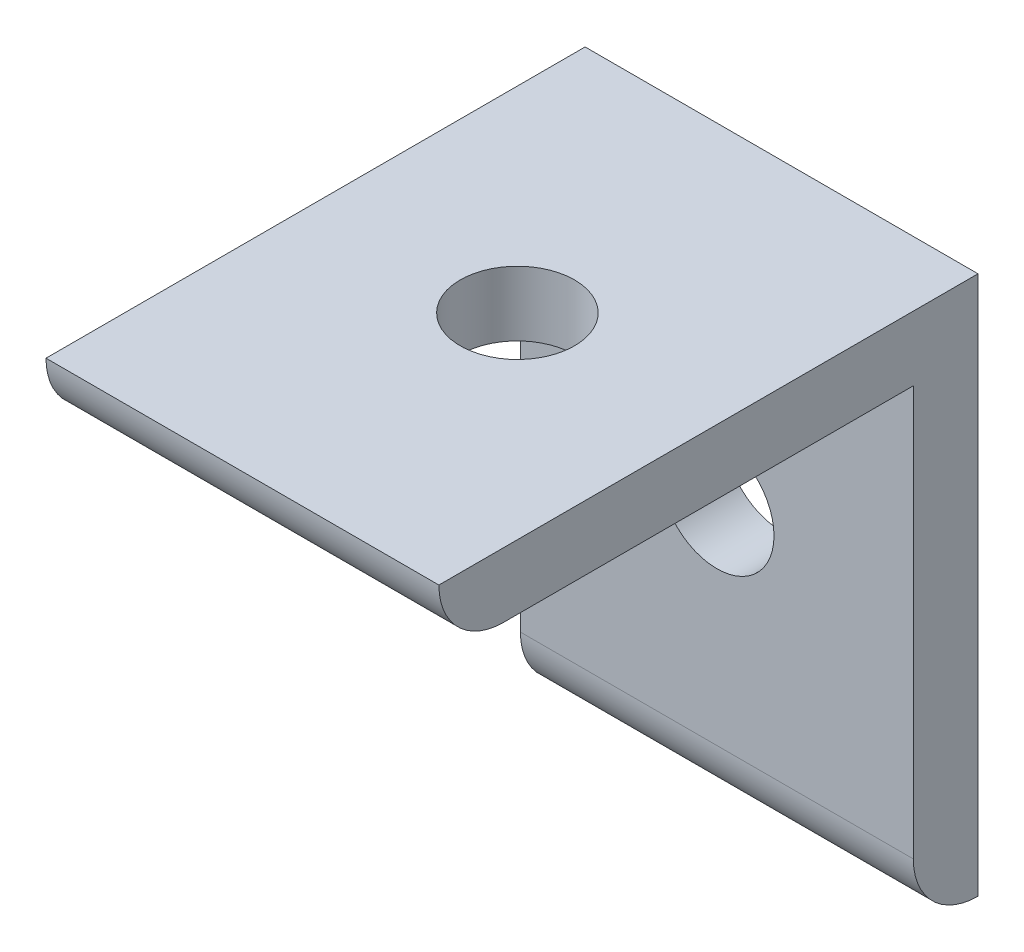
from build123d import *

# Parameters (mm, degrees)
ESBO_O1_W                = 18.22
ESBO_O1_H                = 25
RESSALTO_EXTRUS_O1_DEPTH = 3
ESBO_O2_W                = 18.22
ESBO_O2_H                = 3
RESSALTO_EXTRUS_O2_DEPTH = 22
ESBO_O3_R                = 2.65
CORTE_EXTRUS_O1_DEPTH    = 25
ESBO_O4_R                = 2.65
CORTE_EXTRUS_O2_DEPTH    = 25
FILETE1_R                = 3


with BuildPart() as part:
    # Esboço1 → Ressalto-extrusão1 (new body)
    with BuildSketch(Plane.XY):
        with Locations((-79.470886401, -322.165681156)):
            Rectangle(ESBO_O1_W, ESBO_O1_H)
    extrude(amount=RESSALTO_EXTRUS_O1_DEPTH)

    # Esboço2 → Ressalto-extrusão2 (add)
    with BuildSketch(Plane.XY.offset(3)):
        with Locations((-79.470886401, -311.165681156)):
            Rectangle(ESBO_O2_W, ESBO_O2_H)
    extrude(amount=RESSALTO_EXTRUS_O2_DEPTH)

    # Esboço3 → Corte-extrusão1 (cut)
    with BuildSketch(Plane.XY.offset(3)):
        with Locations((-79.470886401, -321.915681156)):
            Circle(ESBO_O3_R)
    extrude(amount=-CORTE_EXTRUS_O1_DEPTH, mode=Mode.SUBTRACT)

    # Esboço4 → Corte-extrusão2 (cut)
    with BuildSketch(Plane.XZ.offset(312.665681156)):
        with Locations(Location((-79.470886401, 12.25, 0), (0, 0, 270))):
            Circle(ESBO_O4_R)
    extrude(amount=-CORTE_EXTRUS_O2_DEPTH, mode=Mode.SUBTRACT)

    # Filete1
    filete1_edges = [part.edges().sort_by_distance(p)[0] for p in [
        (-79.470886401, -312.665681156, 25),
        (-79.470886401, -334.665681156, 3),
    ]]
    fillet(filete1_edges, radius=FILETE1_R - 0.0001)  # a hair under: the kernel refuses the full size


solid = part.part
